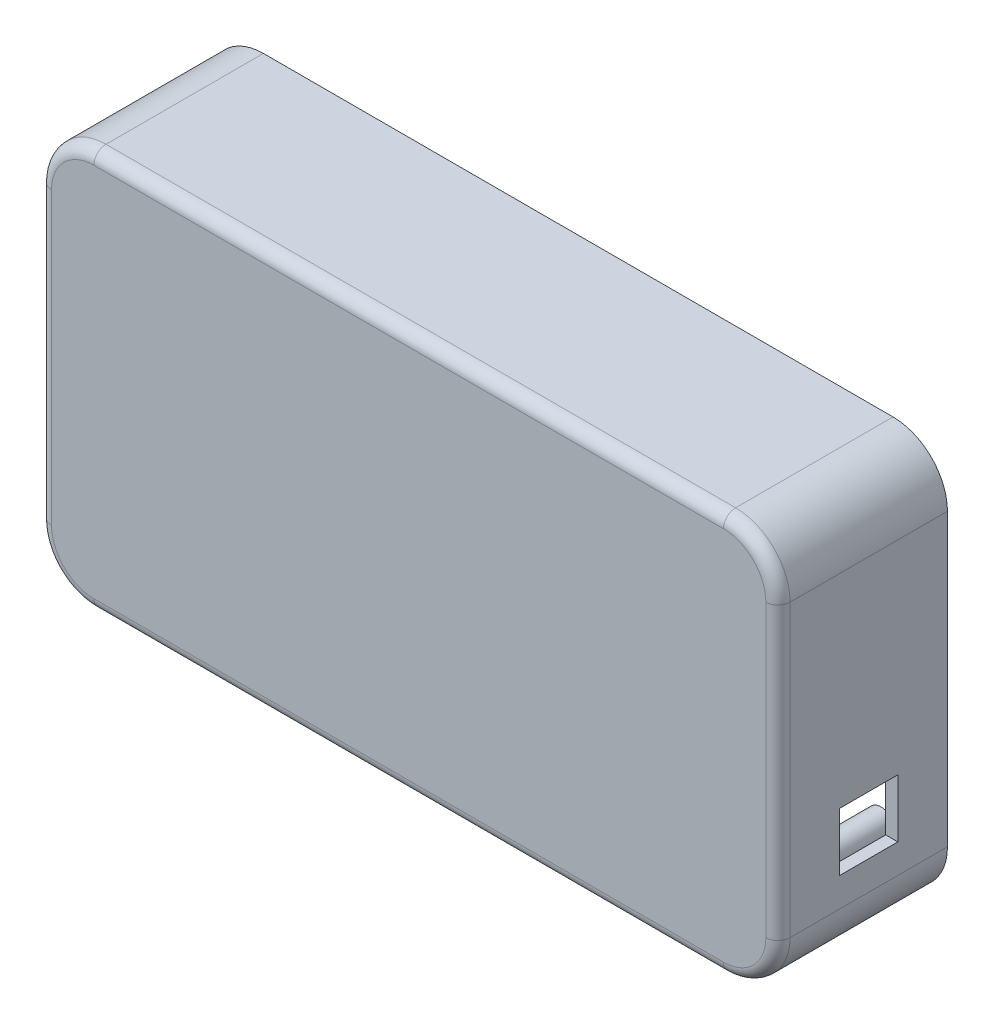
from build123d import *

# Parameters (mm, degrees)
EXTRUDE_1_DEPTH      = 70
SKETCH_1_4_R         = 5.55
CUT_EXTRUDE_1_DEPTH  = 65
CUT_EXTRUDE_2_DEPTH  = 5
SKETCH_1_6_R         = 5.55
SKETCH_1_6_R_2       = 2.55
CUT_EXTRUDE_3_DEPTH  = 5
SKETCH_1_7_R         = 2.55
CUT_EXTRUDE_4_DEPTH  = 40
SKETCH_1_8_R         = 2.55
CUT_EXTRUDE_5_DEPTH  = 40
SKETCH_1_10_R        = 2.55
CUT_EXTRUDE_6_DEPTH  = 40
SKETCH_1_11_R        = 2.55
CUT_EXTRUDE_7_DEPTH  = 40
SKETCH_1_12_R        = 5.55
SKETCH_1_12_R_2      = 2.55
CUT_EXTRUDE_8_DEPTH  = 5
SKETCH_1_13_R        = 5.55
SKETCH_1_13_R_2      = 2.55
CUT_EXTRUDE_9_DEPTH  = 5
SKETCH_1_14_R        = 5.55
SKETCH_1_14_R_2      = 2.55
CUT_EXTRUDE_10_DEPTH = 5
FILLET_2_R           = 5
SKETCH_14_W          = 50
SKETCH_14_H          = 20
CUT_EXTRUDE_11_DEPTH = 5
SKETCH_16_W          = 24
SKETCH_16_H          = 24
CUT_EXTRUDE_12_DEPTH = 5
SKETCH_18_W          = 24
SKETCH_18_H          = 24
CUT_EXTRUDE_13_DEPTH = 5
EXTRUDE_2_DEPTH      = 60
SKETCH_28_W          = 0.621951219
SKETCH_28_H          = 3
CUT_EXTRUDE_17_DEPTH = 1


with BuildPart() as part:
    # 草图1 → 凸台-拉伸1 (new body)
    with BuildSketch(Plane.XY):
        with BuildLine():
            Line((-130, 82.5), (130, 82.5))
            ThreePointArc((130, 82.5), (145.909902577, 75.909902577), (152.5, 60))
            Line((152.5, 60), (152.5, -60))
            ThreePointArc((152.5, -60), (145.909902577, -75.909902577), (130, -82.5))
            Line((130, -82.5), (-130, -82.5))
            ThreePointArc((-130, -82.5), (-145.909902577, -75.909902577), (-152.5, -60))
            Line((-152.5, -60), (-152.5, 60))
            ThreePointArc((-152.5, 60), (-145.909902577, 75.909902577), (-130, 82.5))
        make_face()
    extrude(amount=EXTRUDE_1_DEPTH)

    # 草图1<4> → 切除-拉伸1 (cut)
    with BuildSketch(Plane.XY):
        with BuildLine():
            Line((130, 77.5), (-130, 77.5))
            ThreePointArc((-130, 77.5), (-142.374368671, 72.374368671), (-147.5, 60))
            Line((-147.5, 60), (-147.5, -60))
            ThreePointArc((-147.5, -60), (-142.374368671, -72.374368671), (-130, -77.5))
            Line((-130, -77.5), (130, -77.5))
            ThreePointArc((130, -77.5), (142.374368671, -72.374368671), (147.5, -60))
            Line((147.5, -60), (147.5, 60))
            ThreePointArc((147.5, 60), (142.374368671, 72.374368671), (130, 77.5))
        make_face()
        with Locations((-130, -60)):
            Circle(SKETCH_1_4_R, mode=Mode.SUBTRACT)
        with Locations((130, -60)):
            Circle(SKETCH_1_4_R, mode=Mode.SUBTRACT)
        with Locations((-130, 60)):
            Circle(SKETCH_1_4_R, mode=Mode.SUBTRACT)
        with Locations((130, 60)):
            Circle(SKETCH_1_4_R, mode=Mode.SUBTRACT)
    extrude(amount=CUT_EXTRUDE_1_DEPTH, mode=Mode.SUBTRACT)

    # 草图1<5> → 切除-拉伸2 (cut)
    with BuildSketch(Plane.XY):
        with BuildLine():
            ThreePointArc((-130, 80.2), (-144.28355698, 74.28355698), (-150.2, 60))
            Line((-150.2, 60), (-150.2, -60))
            ThreePointArc((-150.2, -60), (-144.28355698, -74.28355698), (-130, -80.2))
            Line((-130, -80.2), (130, -80.2))
            ThreePointArc((130, -80.2), (144.28355698, -74.28355698), (150.2, -60))
            Line((150.2, -60), (150.2, 60))
            ThreePointArc((150.2, 60), (144.28355698, 74.28355698), (130, 80.2))
            Line((130, 80.2), (-130, 80.2))
        make_face()
        with BuildLine():
            ThreePointArc((-147.5, 60), (-142.374368671, 72.374368671), (-130, 77.5))
            Line((-130, 77.5), (130, 77.5))
            ThreePointArc((130, 77.5), (142.374368671, 72.374368671), (147.5, 60))
            Line((147.5, 60), (147.5, -60))
            ThreePointArc((147.5, -60), (142.374368671, -72.374368671), (130, -77.5))
            Line((130, -77.5), (-130, -77.5))
            ThreePointArc((-130, -77.5), (-142.374368671, -72.374368671), (-147.5, -60))
            Line((-147.5, -60), (-147.5, 60))
        make_face(mode=Mode.SUBTRACT)
    extrude(amount=CUT_EXTRUDE_2_DEPTH, mode=Mode.SUBTRACT)

    # 草图1<6> → 切除-拉伸3 (cut)
    with BuildSketch(Plane.XY):
        with Locations((130, 60)):
            Circle(SKETCH_1_6_R)
        with Locations((130, 60)):
            Circle(SKETCH_1_6_R_2, mode=Mode.SUBTRACT)
    extrude(amount=CUT_EXTRUDE_3_DEPTH, mode=Mode.SUBTRACT)

    # 草图1<7> → 切除-拉伸4 (cut)
    with BuildSketch(Plane.XY):
        with Locations((130, 60)):
            Circle(SKETCH_1_7_R)
    extrude(amount=CUT_EXTRUDE_4_DEPTH, mode=Mode.SUBTRACT)

    # 草图1<8> → 切除-拉伸5 (cut)
    with BuildSketch(Plane.XY):
        with Locations((130, -60)):
            Circle(SKETCH_1_8_R)
    extrude(amount=CUT_EXTRUDE_5_DEPTH, mode=Mode.SUBTRACT)

    # 草图1<10> → 切除-拉伸6 (cut)
    with BuildSketch(Plane.XY):
        with Locations((-130, -60)):
            Circle(SKETCH_1_10_R)
    extrude(amount=CUT_EXTRUDE_6_DEPTH, mode=Mode.SUBTRACT)

    # 草图1<11> → 切除-拉伸7 (cut)
    with BuildSketch(Plane.XY):
        with Locations((-130, 60)):
            Circle(SKETCH_1_11_R)
    extrude(amount=CUT_EXTRUDE_7_DEPTH, mode=Mode.SUBTRACT)

    # 草图1<12> → 切除-拉伸8 (cut)
    with BuildSketch(Plane.XY):
        with Locations((-130, 60)):
            Circle(SKETCH_1_12_R)
        with Locations((-130, 60)):
            Circle(SKETCH_1_12_R_2, mode=Mode.SUBTRACT)
    extrude(amount=CUT_EXTRUDE_8_DEPTH, mode=Mode.SUBTRACT)

    # 草图1<13> → 切除-拉伸9 (cut)
    with BuildSketch(Plane.XY):
        with Locations((-130, -60)):
            Circle(SKETCH_1_13_R)
        with Locations((-130, -60)):
            Circle(SKETCH_1_13_R_2, mode=Mode.SUBTRACT)
    extrude(amount=CUT_EXTRUDE_9_DEPTH, mode=Mode.SUBTRACT)

    # 草图1<14> → 切除-拉伸10 (cut)
    with BuildSketch(Plane.XY):
        with Locations((130, -60)):
            Circle(SKETCH_1_14_R)
        with Locations((130, -60)):
            Circle(SKETCH_1_14_R_2, mode=Mode.SUBTRACT)
    extrude(amount=CUT_EXTRUDE_10_DEPTH, mode=Mode.SUBTRACT)

    # 圆角2
    fillet_2_edges = [part.edges().sort_by_distance(p)[0] for p in [
        (-152.5, 0, 70),
        (0, -82.5, 70),
        (152.5, 0, 70),
        (0, 82.5, 70),
    ]]
    fillet(fillet_2_edges, radius=FILLET_2_R)

    # 草图14 → 切除-拉伸11 (cut)
    with BuildSketch(Plane.XZ.offset(82.5)):
        with Locations((0, 55)):
            Rectangle(SKETCH_14_W, SKETCH_14_H)
    extrude(amount=-CUT_EXTRUDE_11_DEPTH, mode=Mode.SUBTRACT)

    # 草图16 → 切除-拉伸12 (cut)
    with BuildSketch(Plane(origin=(152.5, 0, 0), x_dir=(0, 0, -1), z_dir=(1, 0, 0))):
        with Locations((-32.5, -36)):
            Rectangle(SKETCH_16_W, SKETCH_16_H)
    extrude(amount=-CUT_EXTRUDE_12_DEPTH, mode=Mode.SUBTRACT)

    # 草图18 → 切除-拉伸13 (cut)
    with BuildSketch(Plane.ZY.offset(152.5)):
        with Locations((32.5, -36)):
            Rectangle(SKETCH_18_W, SKETCH_18_H)
    extrude(amount=-CUT_EXTRUDE_13_DEPTH, mode=Mode.SUBTRACT)

    # 草图19 → 凸台-拉伸2 (add)
    with BuildSketch(Plane(origin=(0, 0, 65), x_dir=(-1, 0, 0), z_dir=(0, 0, -1))):
        with BuildLine():
            Line((-103, 50), (-18, 50))
            ThreePointArc((-18, 50), (-14, 46), (-18, 42))
            Line((-18, 42), (-103, 42))
            ThreePointArc((-103, 42), (-107, 46), (-103, 50))
        make_face()
        with BuildLine():
            Line((103, 50), (18, 50))
            ThreePointArc((18, 50), (14, 46), (18, 42))
            Line((18, 42), (103, 42))
            ThreePointArc((103, 42), (107, 46), (103, 50))
        make_face()
        with BuildLine():
            Line((-103, -10), (-18, -10))
            ThreePointArc((-18, -10), (-14, -14), (-18, -18))
            Line((-18, -18), (-103, -18))
            ThreePointArc((-103, -18), (-107, -14), (-103, -10))
        make_face()
        with BuildLine():
            Line((103, -10), (18, -10))
            ThreePointArc((18, -10), (14, -14), (18, -18))
            Line((18, -18), (103, -18))
            ThreePointArc((103, -18), (107, -14), (103, -10))
        make_face()
    extrude(amount=EXTRUDE_2_DEPTH)

    # 草图28 → 切除-拉伸17 (cut)
    # profile 1 of 12: a face of its own
    with BuildSketch(Plane(origin=(0, 0, 5), x_dir=(-1, 0, 0), z_dir=(0, 0, -1))):
        with BuildLine():
            Line((80.384146341, -13.06097561), (80.384146341, -12))
            Line((80.384146341, -12), (81.042682927, -12))
            Line((81.042682927, -12), (81.042682927, -15))
            Line((81.042682927, -15), (80.006859756, -15))
            add(Edge.make_bspline(
                [(80.006859756, -15), (79.961479418, -14.999503633), (79.87361159, -14.99854254), (79.746304446, -14.986562483), (79.627581035, -14.968820048), (79.517425839, -14.943151197), (79.415825389, -14.910343596), (79.323300006, -14.869429025), (79.238898444, -14.822319695), (79.164268715, -14.766238818), (79.097779475, -14.70359415), (79.040134554, -14.633409047), (78.99188706, -14.555403322), (78.952362713, -14.470154314), (78.921346151, -14.377583496), (78.900071449, -14.277464991), (78.886698413, -14.170330476), (78.885012621, -14.096458902), (78.884146341, -14.058498476)],
                knots=[0, 0, 0, 0, 1.298309684, 2.513856393, 3.656108695, 4.731525363, 5.747269452, 6.706842141, 7.622696522, 8.50723259, 9.371308978, 10.231556582, 11.09863924, 11.989139744, 12.915198226, 13.88644584, 14.913906774, 16, 16, 16, 16], degree=3))
            add(Edge.make_bspline(
                [(78.884146341, -14.058498476), (78.885013307, -14.021272958), (78.886711261, -13.948366695), (78.903581335, -13.842163665), (78.928685577, -13.740985732), (78.966317149, -13.646083274), (79.013511237, -13.556331972), (79.071468039, -13.472633969), (79.140376689, -13.395013177), (79.218344717, -13.323395194), (79.304335332, -13.259035564), (79.396592881, -13.203590213), (79.49402658, -13.156921785), (79.596579049, -13.119131351), (79.704536812, -13.090548423), (79.817779495, -13.071210485), (79.93615522, -13.060851645), (80.016749247, -13.060933819), (80.05773628, -13.06097561)],
                knots=[0, 0, 0, 0, 1.030031435, 2.017318961, 2.9707634, 3.911434012, 4.836705747, 5.773461207, 6.723043161, 7.705184701, 8.700351159, 9.692154612, 10.681034209, 11.68770297, 12.714187277, 13.76904456, 14.865421547, 16, 16, 16, 16], degree=3))
            Line((80.05773628, -13.06097561), (80.384146341, -13.06097561))
        make_face()
        with BuildLine():
            Line((80.401295732, -14.524390244), (80.401295732, -13.536585366))
            Line((80.401295732, -13.536585366), (80.118330793, -13.536585366))
            add(Edge.make_bspline(
                [(80.118330793, -13.536585366), (80.095064743, -13.536778598), (80.049963913, -13.537153174), (79.984709193, -13.543899544), (79.923688885, -13.553252093), (79.867329537, -13.566981838), (79.815053858, -13.583961658), (79.767798249, -13.605656177), (79.724860415, -13.631110707), (79.686055895, -13.66020658), (79.652613773, -13.694182881), (79.622773905, -13.731325445), (79.597461253, -13.772482976), (79.577874395, -13.818149594), (79.561318552, -13.86693942), (79.55107338, -13.92001949), (79.543823987, -13.97674328), (79.543071025, -14.015980331), (79.542682927, -14.036204268)],
                knots=[0, 0, 0, 0, 1.278264899, 2.477894098, 3.602370215, 4.669373304, 5.663063542, 6.619223296, 7.520996807, 8.402964925, 9.276935434, 10.134111266, 11.017943356, 11.922995833, 12.86038281, 13.844364746, 14.88892179, 16, 16, 16, 16], degree=3))
            add(Edge.make_bspline(
                [(79.542682927, -14.036204268), (79.543085748, -14.055853896), (79.543870529, -14.094135534), (79.550981171, -14.14956841), (79.561641382, -14.2015033), (79.576850556, -14.249559353), (79.597168084, -14.293637792), (79.621919072, -14.333929433), (79.65089816, -14.370630426), (79.684949961, -14.402947478), (79.722411139, -14.432460876), (79.765470638, -14.456841362), (79.812445817, -14.478173977), (79.864047707, -14.495139779), (79.919947072, -14.508144403), (79.980088873, -14.517877805), (80.044857485, -14.523603352), (80.089546175, -14.524122343), (80.112614329, -14.524390244)],
                knots=[0, 0, 0, 0, 1.096807385, 2.136813243, 3.115574441, 4.054422268, 4.94474187, 5.818891163, 6.689666352, 7.547538513, 8.435055958, 9.345744162, 10.302983784, 11.312439221, 12.373194966, 13.505006157, 14.712092391, 16, 16, 16, 16], degree=3))
            Line((80.112614329, -14.524390244), (80.401295732, -14.524390244))
        make_face(mode=Mode.SUBTRACT)
    # profile 2 of 12: a face of its own
    with BuildSketch(Plane(origin=(0, 0, 5), x_dir=(-1, 0, 0), z_dir=(0, 0, -1))):
        with BuildLine():
            Line((76.615853659, -13.06097561), (76.615853659, -12))
            Line((76.615853659, -12), (77.274390244, -12))
            Line((77.274390244, -12), (77.274390244, -15))
            Line((77.274390244, -15), (76.238567073, -15))
            add(Edge.make_bspline(
                [(76.238567073, -15), (76.193186735, -14.999503633), (76.105318907, -14.99854254), (75.978011763, -14.986562483), (75.859288352, -14.968820048), (75.749133156, -14.943151197), (75.647532706, -14.910343596), (75.555007323, -14.869429025), (75.470605761, -14.822319695), (75.395976032, -14.766238818), (75.329486792, -14.70359415), (75.271841871, -14.633409047), (75.223594377, -14.555403322), (75.18407003, -14.470154314), (75.153053468, -14.377583496), (75.131778766, -14.277464991), (75.11840573, -14.170330476), (75.116719938, -14.096458902), (75.115853659, -14.058498476)],
                knots=[0, 0, 0, 0, 1.298309684, 2.513856393, 3.656108695, 4.731525363, 5.747269452, 6.706842141, 7.622696522, 8.50723259, 9.371308978, 10.231556582, 11.09863924, 11.989139744, 12.915198226, 13.88644584, 14.913906774, 16, 16, 16, 16], degree=3))
            add(Edge.make_bspline(
                [(75.115853659, -14.058498476), (75.116720624, -14.021272958), (75.118418578, -13.948366695), (75.135288652, -13.842163665), (75.160392894, -13.740985732), (75.198024466, -13.646083274), (75.245218554, -13.556331972), (75.303175356, -13.472633969), (75.372084006, -13.395013177), (75.450052034, -13.323395194), (75.536042649, -13.259035564), (75.628300198, -13.203590213), (75.725733897, -13.156921785), (75.828286367, -13.119131351), (75.936244129, -13.090548423), (76.049486812, -13.071210485), (76.167862537, -13.060851645), (76.248456564, -13.060933819), (76.289443598, -13.06097561)],
                knots=[0, 0, 0, 0, 1.030031435, 2.017318961, 2.9707634, 3.911434012, 4.836705747, 5.773461207, 6.723043161, 7.705184701, 8.700351159, 9.692154612, 10.681034209, 11.68770297, 12.714187277, 13.76904456, 14.865421547, 16, 16, 16, 16], degree=3))
            Line((76.289443598, -13.06097561), (76.615853659, -13.06097561))
        make_face()
        with BuildLine():
            Line((76.633003049, -14.524390244), (76.633003049, -13.536585366))
            Line((76.633003049, -13.536585366), (76.35003811, -13.536585366))
            add(Edge.make_bspline(
                [(76.35003811, -13.536585366), (76.32677206, -13.536778598), (76.28167123, -13.537153174), (76.21641651, -13.543899544), (76.155396202, -13.553252093), (76.099036854, -13.566981838), (76.046761175, -13.583961658), (75.999505566, -13.605656177), (75.956567732, -13.631110707), (75.917763212, -13.66020658), (75.88432109, -13.694182881), (75.854481222, -13.731325445), (75.82916857, -13.772482976), (75.809581712, -13.818149594), (75.793025869, -13.86693942), (75.782780697, -13.92001949), (75.775531304, -13.97674328), (75.774778342, -14.015980331), (75.774390244, -14.036204268)],
                knots=[0, 0, 0, 0, 1.278264899, 2.477894098, 3.602370215, 4.669373304, 5.663063542, 6.619223296, 7.520996807, 8.402964925, 9.276935434, 10.134111266, 11.017943356, 11.922995833, 12.86038281, 13.844364746, 14.88892179, 16, 16, 16, 16], degree=3))
            add(Edge.make_bspline(
                [(75.774390244, -14.036204268), (75.774793065, -14.055853896), (75.775577846, -14.094135534), (75.782688488, -14.14956841), (75.793348699, -14.2015033), (75.808557873, -14.249559353), (75.828875402, -14.293637792), (75.853626389, -14.333929433), (75.882605477, -14.370630426), (75.916657278, -14.402947478), (75.954118456, -14.432460876), (75.997177956, -14.456841362), (76.044153134, -14.478173977), (76.095755024, -14.495139779), (76.151654389, -14.508144403), (76.21179619, -14.517877805), (76.276564802, -14.523603352), (76.321253492, -14.524122343), (76.344321646, -14.524390244)],
                knots=[0, 0, 0, 0, 1.096807385, 2.136813243, 3.115574441, 4.054422268, 4.94474187, 5.818891163, 6.689666352, 7.547538513, 8.435055958, 9.345744162, 10.302983784, 11.312439221, 12.373194966, 13.505006157, 14.712092391, 16, 16, 16, 16], degree=3))
            Line((76.344321646, -14.524390244), (76.633003049, -14.524390244))
        make_face(mode=Mode.SUBTRACT)
    # profile 3 of 12: a face of its own
    with BuildSketch(Plane(origin=(0, 0, 5), x_dir=(-1, 0, 0), z_dir=(0, 0, -1))):
        with BuildLine():
            add(Edge.make_bspline(
                [(71.054878049, -12.213224085), (71.092313954, -12.193187917), (71.16808542, -12.152634072), (71.288376922, -12.102350745), (71.414829145, -12.05927485), (71.547375381, -12.0239713), (71.686381903, -11.996470603), (71.831496485, -11.977327801), (71.983041955, -11.965734339), (72.086107156, -11.964198595), (72.138719512, -11.963414634)],
                knots=[0, 0, 0, 0, 0.905764502, 1.833296254, 2.778524791, 3.755102668, 4.758409924, 5.800558306, 6.877236841, 8, 8, 8, 8], degree=3))
            add(Edge.make_bspline(
                [(72.138719512, -11.963414634), (72.197083047, -11.96454775), (72.311079456, -11.966760968), (72.4771873, -11.986152858), (72.633963101, -12.016521922), (72.781360819, -12.059925766), (72.918993135, -12.116694451), (73.047296815, -12.185703034), (73.166623671, -12.266483507), (73.275104148, -12.360387598), (73.372163769, -12.465090021), (73.457753621, -12.578881528), (73.529232028, -12.70246211), (73.587900658, -12.835126345), (73.633675693, -12.976893338), (73.665872607, -13.127816679), (73.685809434, -13.287764783), (73.687934107, -13.397424433), (73.68902439, -13.453696646)],
                knots=[0, 0, 0, 0, 1.150308723, 2.246797832, 3.292262244, 4.295476905, 5.270793765, 6.222142612, 7.163057208, 8.105964619, 9.044318326, 9.972988713, 10.907280248, 11.852489879, 12.827864619, 13.838828932, 14.890987884, 16, 16, 16, 16], degree=3))
            add(Edge.make_bspline(
                [(73.68902439, -13.453696646), (73.688774385, -13.482672532), (73.688280447, -13.539920604), (73.681952291, -13.624735321), (73.673870863, -13.707589883), (73.66131352, -13.78833163), (73.644340638, -13.86675859), (73.625203756, -13.943611825), (73.601986605, -14.018346382), (73.573982001, -14.090499652), (73.543998851, -14.161214191), (73.509547635, -14.229584847), (73.47194546, -14.296221244), (73.429843274, -14.360211575), (73.384883978, -14.422598495), (73.335960982, -14.482670258), (73.284073913, -14.541219483), (73.20952413, -14.615466914), (73.109533314, -14.701022606), (72.98043563, -14.791769851), (72.841160246, -14.867308437), (72.692790137, -14.929082213), (72.535741153, -14.977948368), (72.369326733, -15.011861738), (72.19394845, -15.03288087), (72.073803279, -15.035332238), (72.012385671, -15.036585366)],
                knots=[0, 0, 0, 0, 0.804008257, 1.588490589, 2.359415033, 3.114115391, 3.85469397, 4.585808504, 5.311740349, 6.024805626, 6.733109078, 7.442635548, 8.148446986, 8.855465972, 9.567392887, 10.281829633, 11.004730757, 11.737679193, 13.200405481, 14.651363498, 16.109186693, 17.588340932, 19.105513233, 20.666480423, 22.295921515, 24, 24, 24, 24], degree=3))
            add(Edge.make_bspline(
                [(72.012385671, -15.036585366), (71.972551396, -15.036127525), (71.894167027, -15.035226604), (71.778440305, -15.028667414), (71.666608797, -15.018882987), (71.558806336, -15.003430009), (71.454409453, -14.985891423), (71.354310314, -14.961919143), (71.257485266, -14.935619047), (71.1953827, -14.913681806), (71.164634146, -14.902820122)],
                knots=[0, 0, 0, 0, 1.108229999, 2.180732801, 3.224212248, 4.230392862, 5.210078469, 6.168137424, 7.092998441, 8, 8, 8, 8], degree=3))
            Line((71.164634146, -14.902820122), (71.164634146, -14.304878049))
            add(Edge.make_bspline(
                [(71.164634146, -14.304878049), (71.194844233, -14.322549461), (71.255685046, -14.35813834), (71.352881554, -14.402388462), (71.454731064, -14.440140421), (71.561534128, -14.471066345), (71.673292379, -14.495027072), (71.7899784, -14.511951309), (71.911580223, -14.522524084), (71.994261501, -14.52376029), (72.036394817, -14.524390244)],
                knots=[0, 0, 0, 0, 0.9220621, 1.85696284, 2.810499976, 3.783315138, 4.785220574, 5.82089063, 6.889553879, 8, 8, 8, 8], degree=3))
            add(Edge.make_bspline(
                [(72.036394817, -14.524390244), (72.072448117, -14.523490586), (72.143275156, -14.521723199), (72.246855004, -14.508474899), (72.345191992, -14.486410493), (72.437909448, -14.45446052), (72.525789376, -14.414718102), (72.608136168, -14.365038309), (72.684947406, -14.306331997), (72.756304136, -14.239598214), (72.820741068, -14.165513913), (72.877108484, -14.085055912), (72.924711108, -13.99879371), (72.963916273, -13.906942801), (72.993269613, -13.809028733), (73.015218236, -13.706036547), (73.027710095, -13.597104625), (73.029546406, -13.522706367), (73.030487805, -13.484565549)],
                knots=[0, 0, 0, 0, 1.068568043, 2.099211781, 3.089950087, 4.051000015, 5.001416445, 5.944011771, 6.895283926, 7.862423631, 8.835401866, 9.800725282, 10.769101412, 11.751137938, 12.755343674, 13.794527825, 14.86934834, 16, 16, 16, 16], degree=3))
            add(Edge.make_bspline(
                [(73.030487805, -13.484565549), (73.029684754, -13.445861629), (73.028122444, -13.370564357), (73.017030423, -13.260887053), (72.996504956, -13.158232526), (72.970294933, -13.061416711), (72.934557914, -12.971553544), (72.891565305, -12.887882731), (72.840576437, -12.810825314), (72.781497783, -12.741183722), (72.716205587, -12.678681463), (72.645007643, -12.623707833), (72.567287043, -12.578274514), (72.484662809, -12.539821541), (72.395705346, -12.511792435), (72.301536177, -12.490316686), (72.201371264, -12.477696777), (72.132657154, -12.476315336), (72.097560976, -12.475609756)],
                knots=[0, 0, 0, 0, 1.192903147, 2.320756001, 3.39190871, 4.416435883, 5.407770308, 6.366507788, 7.31123856, 8.248933498, 9.175230166, 10.092622087, 11.014215195, 11.94450602, 12.89540485, 13.882764997, 14.918608447, 16, 16, 16, 16], degree=3))
            add(Edge.make_bspline(
                [(72.097560976, -12.475609756), (72.0565414, -12.476373932), (71.978252447, -12.477832419), (71.866732776, -12.491844757), (71.766314049, -12.513311921), (71.705734271, -12.537323579), (71.676829268, -12.548780488)],
                knots=[0, 0, 0, 0, 1.144267593, 2.183921005, 3.133477062, 4, 4, 4, 4], degree=3))
            Line((71.676829268, -12.548780488), (71.676829268, -13.170731707))
            Line((71.676829268, -13.170731707), (72.298780488, -13.170731707))
            Line((72.298780488, -13.170731707), (72.298780488, -13.682926829))
            Line((72.298780488, -13.682926829), (71.054878049, -13.682926829))
            Line((71.054878049, -13.682926829), (71.054878049, -12.213224085))
        make_face()
    # profile 4 of 12: a face of its own
    with BuildSketch(Plane(origin=(0, 0, 5), x_dir=(-1, 0, 0), z_dir=(0, 0, -1))):
        Polygon((67.506097561, -12), (69.298780488, -12), (69.298780488, -15), (67.579268293, -15), (67.579268293, -14.487804878), (68.653391768, -14.487804878), (68.653391768, -13.756097561), (67.652439024, -13.756097561), (67.652439024, -13.243902439), (68.640243902, -13.243902439), (68.640243902, -12.512195122), (67.506097561, -12.512195122), align=None)
    # profile 5 of 12: a face of its own
    with BuildSketch(Plane(origin=(0, 0, 5), x_dir=(-1, 0, 0), z_dir=(0, 0, -1))):
        with BuildLine():
            Line((63.408536585, -12), (64.215129573, -12))
            Line((64.215129573, -12), (65.14691311, -13.311356707))
            add(Edge.make_bspline(
                [(65.14691311, -13.311356707), (65.153105315, -13.320824523), (65.166724093, -13.341647492), (65.186772178, -13.377155315), (65.206896036, -13.420301308), (65.220709935, -13.451387192), (65.22808689, -13.467987805)],
                knots=[0, 0, 0, 0, 0.768222517, 1.689584372, 2.76618222, 4, 4, 4, 4], degree=3))
            Line((65.22808689, -13.467987805), (65.237804878, -13.467987805))
            Line((65.237804878, -13.467987805), (65.237804878, -12))
            Line((65.237804878, -12), (65.859756098, -12))
            Line((65.859756098, -12), (65.859756098, -15))
            Line((65.859756098, -15), (65.237804878, -15))
            Line((65.237804878, -15), (65.237804878, -13.582317073))
            Line((65.237804878, -13.582317073), (65.22808689, -13.582317073))
            add(Edge.make_bspline(
                [(65.22808689, -13.582317073), (65.213895948, -13.611543837), (65.187235364, -13.666452285), (65.15547834, -13.71857224), (65.140625, -13.742949695)],
                knots=[0, 0, 0, 0, 1.064563444, 2, 2, 2, 2], degree=3))
            Line((65.140625, -13.742949695), (64.241996951, -15))
            Line((64.241996951, -15), (63.481707317, -15))
            Line((63.481707317, -15), (64.578696646, -13.568597561))
            Line((64.578696646, -13.568597561), (63.408536585, -12))
        make_face()
    # profile 6 of 12: a face of its own
    with BuildSketch(Plane(origin=(0, 0, 5), x_dir=(-1, 0, 0), z_dir=(0, 0, -1))):
        with Locations((61.634146341, -13.5)):
            Rectangle(SKETCH_28_W, SKETCH_28_H)
    # profile 7 of 12: a face of its own
    with BuildSketch(Plane(origin=(0, 0, 5), x_dir=(-1, 0, 0), z_dir=(0, 0, -1))):
        with BuildLine():
            add(Edge.make_bspline(
                [(56.923780488, -14.193407012), (56.9285335, -14.156820247), (56.937841615, -14.085170149), (56.951659948, -13.980215183), (56.964280761, -13.880180858), (56.975514794, -13.785240059), (56.986615271, -13.695352233), (56.996277551, -13.610548866), (57.004734176, -13.530675438), (57.012961162, -13.456022718), (57.019588694, -13.386238454), (57.026072463, -13.321679317), (57.031303632, -13.262038633), (57.035094384, -13.207319415), (57.038735695, -13.157611348), (57.041075838, -13.113014802), (57.04215283, -13.073556627), (57.04251466, -13.048971386), (57.042682927, -13.03753811)],
                knots=[0, 0, 0, 0, 1.523421869, 2.983410193, 4.371160344, 5.686705542, 6.931005549, 8.110953867, 9.210965315, 10.247551913, 11.212088821, 12.105383437, 12.926721091, 13.68406122, 14.370209323, 14.984725295, 15.527850191, 16, 16, 16, 16], degree=3))
            add(Edge.make_bspline(
                [(57.042682927, -13.03753811), (57.042142468, -13.013698455), (57.041127238, -12.9689166), (57.033571031, -12.90632914), (57.020135813, -12.85315855), (57.001483732, -12.809066113), (56.976766347, -12.774012017), (56.945449901, -12.749089074), (56.908474102, -12.733893397), (56.882005274, -12.732451987), (56.868330793, -12.731707317)],
                knots=[0, 0, 0, 0, 1.448452767, 2.720861672, 3.821719873, 4.770439391, 5.615739201, 6.39871397, 7.172734258, 8, 8, 8, 8], degree=3))
            add(Edge.make_bspline(
                [(56.868330793, -12.731707317), (56.853587387, -12.732306395), (56.82425962, -12.73349809), (56.781583022, -12.744963169), (56.741050683, -12.762839145), (56.702687376, -12.787999483), (56.666711617, -12.820513922), (56.632331092, -12.859597151), (56.600182939, -12.905828453), (56.57103626, -12.958721006), (56.544369747, -13.016826601), (56.520626677, -13.079358731), (56.501837734, -13.146310085), (56.484834947, -13.216731212), (56.472364865, -13.291234839), (56.46427607, -13.369724177), (56.458031829, -13.452073694), (56.457558892, -13.508371322), (56.457317073, -13.537157012)],
                knots=[0, 0, 0, 0, 0.714230219, 1.420755723, 2.128732248, 2.857189196, 3.636687255, 4.475325276, 5.378384261, 6.363729259, 7.402314615, 8.479262945, 9.606001351, 10.774654019, 11.993946383, 13.268450415, 14.603324099, 16, 16, 16, 16], degree=3))
            add(Edge.make_bspline(
                [(56.457317073, -13.537157012), (56.458370313, -13.577783008), (56.460434027, -13.657385408), (56.474703426, -13.7740045), (56.49931683, -13.884823792), (56.533796663, -13.990129186), (56.577722031, -14.089884727), (56.631974227, -14.183990061), (56.696382171, -14.271950364), (56.76924919, -14.354557662), (56.851552626, -14.428712215), (56.941936362, -14.493852444), (57.04010807, -14.548918314), (57.146233591, -14.593569343), (57.259777446, -14.628521909), (57.381033291, -14.652663641), (57.509712239, -14.667884254), (57.598088176, -14.669765427), (57.643483232, -14.670731707)],
                knots=[0, 0, 0, 0, 1.053066179, 2.063373308, 3.040084114, 3.991370503, 4.931251778, 5.860691054, 6.801285957, 7.752969819, 8.711245466, 9.666741759, 10.635413037, 11.622584861, 12.645981234, 13.709652112, 14.823543229, 16, 16, 16, 16], degree=3))
            add(Edge.make_bspline(
                [(57.643483232, -14.670731707), (57.691770463, -14.669682971), (57.786681994, -14.667621614), (57.925618531, -14.646634178), (58.05877916, -14.614512666), (58.185350097, -14.567869696), (58.305879033, -14.508505973), (58.420090935, -14.436305836), (58.527573256, -14.350179777), (58.627716265, -14.252444303), (58.719528692, -14.145874805), (58.799029893, -14.031599934), (58.867042563, -13.912121761), (58.922797211, -13.786981327), (58.965880248, -13.655965478), (58.995808562, -13.519377198), (59.014755312, -13.377245324), (59.017099435, -13.280548565), (59.018292683, -13.23132622)],
                knots=[0, 0, 0, 0, 1.043032563, 2.050144843, 3.030117198, 3.999577363, 4.959258962, 5.929375104, 6.914182594, 7.930717372, 8.950185061, 9.949968611, 10.934931123, 11.917695218, 12.906276573, 13.910555001, 14.936392663, 16, 16, 16, 16], degree=3))
            add(Edge.make_bspline(
                [(59.018292683, -13.23132622), (59.017195193, -13.183449991), (59.015050188, -13.089877669), (58.998319388, -12.953418626), (58.970588654, -12.824671204), (58.930929507, -12.704050296), (58.88067864, -12.591080483), (58.81827156, -12.486480955), (58.745477085, -12.389126504), (58.661169463, -12.3006331), (58.567620454, -12.221333921), (58.465518707, -12.152051735), (58.355184328, -12.093743329), (58.236900493, -12.04552178), (58.110468371, -12.008369207), (57.976078808, -11.98253809), (57.833873053, -11.9660083), (57.736328077, -11.964293242), (57.686356707, -11.963414634)],
                knots=[0, 0, 0, 0, 1.103832906, 2.157400693, 3.164988995, 4.136318075, 5.080418332, 6.010382147, 6.939327984, 7.878033749, 8.82271673, 9.762399076, 10.717762981, 11.695343904, 12.703392038, 13.751327329, 14.848026231, 16, 16, 16, 16], degree=3))
            add(Edge.make_bspline(
                [(57.686356707, -11.963414634), (57.647278037, -11.96394929), (57.569978125, -11.965006869), (57.455305947, -11.973877803), (57.34328447, -11.988017937), (57.233922149, -12.008020947), (57.127244493, -12.033824296), (57.023220241, -12.065258701), (56.92157097, -12.102276307), (56.855970811, -12.131653078), (56.823170732, -12.146341463)],
                knots=[0, 0, 0, 0, 1.054297098, 2.085461798, 3.101337278, 4.099692842, 5.083579589, 6.061105223, 7.030552611, 8, 8, 8, 8], degree=3))
            Line((56.823170732, -12.146341463), (56.823170732, -11.754192073))
            add(Edge.make_bspline(
                [(56.823170732, -11.754192073), (56.853888781, -11.741596655), (56.9166747, -11.715852349), (57.01602688, -11.684012255), (57.122076945, -11.657448341), (57.234559305, -11.634871906), (57.353975515, -11.61899115), (57.479759753, -11.606114535), (57.612334231, -11.598707521), (57.702925589, -11.597948833), (57.749237805, -11.597560976)],
                knots=[0, 0, 0, 0, 0.842369109, 1.721753814, 2.644852369, 3.61605255, 4.631689652, 5.700936581, 6.824670199, 8, 8, 8, 8], degree=3))
            add(Edge.make_bspline(
                [(57.749237805, -11.597560976), (57.781257762, -11.597877493), (57.844577338, -11.598503406), (57.93838585, -11.603872677), (58.029989866, -11.612088549), (58.119128674, -11.62510507), (58.206244485, -11.640089459), (58.290881626, -11.659702006), (58.373165931, -11.682729038), (58.453537407, -11.708109607), (58.531204684, -11.738147765), (58.606865627, -11.770911324), (58.679459681, -11.808686428), (58.750498454, -11.848424448), (58.819336968, -11.891923159), (58.885329754, -11.939363254), (58.949308325, -11.990019796), (59.010698061, -12.04387495), (59.068702736, -12.101109019), (59.124012401, -12.160093971), (59.175426207, -12.221550886), (59.222327241, -12.28600649), (59.265785594, -12.352415001), (59.306124891, -12.420777768), (59.341312286, -12.492405919), (59.374150938, -12.565527014), (59.402048312, -12.641696254), (59.426671, -12.71966647), (59.447205274, -12.800248356), (59.464413013, -12.882806198), (59.477434994, -12.967938419), (59.4872162, -13.055262706), (59.493058073, -13.145117304), (59.493618806, -13.205784135), (59.493902439, -13.236471037)],
                knots=[0, 0, 0, 0, 1.139729665, 2.253819379, 3.34386206, 4.412484346, 5.459643503, 6.489680893, 7.503419623, 8.500893191, 9.488516358, 10.466495726, 11.434212398, 12.400073063, 13.363549001, 14.331051701, 15.29187366, 16.267521502, 17.236426053, 18.19148447, 19.145072434, 20.086618682, 21.027284935, 21.969612712, 22.909985449, 23.866608255, 24.821666671, 25.795638972, 26.776155499, 27.780524128, 28.796461688, 29.840650861, 30.907743603, 32, 32, 32, 32], degree=3))
            add(Edge.make_bspline(
                [(59.493902439, -13.236471037), (59.493695532, -13.268116273), (59.49328627, -13.330710268), (59.486312106, -13.423536084), (59.477255286, -13.514447395), (59.462373698, -13.603193413), (59.445172794, -13.690373538), (59.422462454, -13.775265309), (59.397101524, -13.858696943), (59.366306519, -13.939658693), (59.33311183, -14.019447329), (59.294198113, -14.096450403), (59.252940127, -14.172323435), (59.206089858, -14.245244548), (59.156533445, -14.317207646), (59.102121431, -14.386526844), (59.044250157, -14.454518994), (58.982104803, -14.519628221), (58.917526305, -14.582516968), (58.849543727, -14.640770562), (58.780150435, -14.695898149), (58.707775643, -14.746132737), (58.633343538, -14.792804591), (58.556069908, -14.834636331), (58.477304331, -14.874016895), (58.395809573, -14.908113147), (58.312119342, -14.938645675), (58.225976171, -14.964645447), (58.137764098, -14.987293957), (58.046996268, -15.004676228), (57.954163819, -15.019033671), (57.85881628, -15.029510054), (57.761306833, -15.034969058), (57.695508882, -15.03604374), (57.662347561, -15.036585366)],
                knots=[0, 0, 0, 0, 1.055967408, 2.088694104, 3.105731401, 4.104304765, 5.090957784, 6.070554152, 7.036175772, 8.000183181, 8.960596085, 9.919153932, 10.878534348, 11.841954102, 12.810587284, 13.794037141, 14.781919379, 15.789686715, 16.797253329, 17.789283132, 18.776653381, 19.754141443, 20.728333929, 21.707496606, 22.685977379, 23.666440556, 24.654322793, 25.658289687, 26.668682805, 27.692755764, 28.741592915, 29.803576736, 30.893030921, 32, 32, 32, 32], degree=3))
            add(Edge.make_bspline(
                [(57.662347561, -15.036585366), (57.600929078, -15.035524312), (57.481008477, -15.033452588), (57.305857923, -15.013017654), (57.139359562, -14.982640887), (56.982330732, -14.936871168), (56.833724107, -14.879876709), (56.694426556, -14.809457022), (56.564396732, -14.725856977), (56.444142526, -14.630896356), (56.335650974, -14.525391996), (56.240551487, -14.41126188), (56.160563265, -14.288569874), (56.095193739, -14.158109361), (56.043776929, -14.019993019), (56.008170223, -13.873789209), (55.985874338, -13.720007388), (55.983114027, -13.61478803), (55.981707317, -13.561166159)],
                knots=[0, 0, 0, 0, 1.172184142, 2.288708891, 3.362594693, 4.40006907, 5.406766622, 6.397653929, 7.374570214, 8.353577624, 9.318387134, 10.258888517, 11.184236923, 12.108404466, 13.039677363, 13.991781463, 14.976572015, 16, 16, 16, 16], degree=3))
            add(Edge.make_bspline(
                [(55.981707317, -13.561166159), (55.982599939, -13.517307373), (55.984346649, -13.431483097), (55.997562438, -13.306064804), (56.019687352, -13.18707776), (56.051201722, -13.074833385), (56.091023564, -12.968945894), (56.140687184, -12.87018294), (56.198348706, -12.777515605), (56.26519056, -12.692899104), (56.338171106, -12.616403431), (56.41577788, -12.54909255), (56.498402221, -12.4926458), (56.584659983, -12.446014238), (56.675550085, -12.410353548), (56.77019036, -12.384602544), (56.869317855, -12.368668746), (56.936868554, -12.366802762), (56.971227134, -12.365853659)],
                knots=[0, 0, 0, 0, 1.212531633, 2.372720733, 3.482527589, 4.555078219, 5.592301276, 6.605480189, 7.606836371, 8.604971677, 9.581315616, 10.526528093, 11.439897802, 12.342706025, 13.232054118, 14.133138835, 15.050450991, 16, 16, 16, 16], degree=3))
            add(Edge.make_bspline(
                [(56.971227134, -12.365853659), (56.988005936, -12.366179315), (57.02069372, -12.366813747), (57.068751448, -12.37188284), (57.114288103, -12.381345582), (57.158153517, -12.392904036), (57.199447613, -12.409400495), (57.239095234, -12.428350958), (57.275660313, -12.452447572), (57.310505241, -12.478452883), (57.342697103, -12.507215449), (57.370058599, -12.539784841), (57.394454692, -12.574134305), (57.414544877, -12.611333034), (57.429784781, -12.651262224), (57.441945057, -12.693079807), (57.450104135, -12.737519906), (57.452101311, -12.768068765), (57.453125, -12.783727134)],
                knots=[0, 0, 0, 0, 1.130917494, 2.203207897, 3.251066508, 4.263779692, 5.256005313, 6.243982268, 7.220201173, 8.201476495, 9.174309855, 10.12162718, 11.06230394, 12.010491561, 12.962152409, 13.937779692, 14.942971815, 16, 16, 16, 16], degree=3))
            Line((57.453125, -12.783727134), (57.466844512, -12.783727134))
            add(Edge.make_bspline(
                [(57.466844512, -12.783727134), (57.479252716, -12.750828507), (57.503073038, -12.687672239), (57.549262982, -12.601528479), (57.604193982, -12.52873429), (57.666951492, -12.469173602), (57.73722629, -12.422317969), (57.815424311, -12.389643467), (57.900979344, -12.368841502), (57.960812391, -12.366869098), (57.991615854, -12.365853659)],
                knots=[0, 0, 0, 0, 1.166057998, 2.238509006, 3.231342415, 4.179679313, 5.09695759, 6.017803703, 6.979518613, 8, 8, 8, 8], degree=3))
            add(Edge.make_bspline(
                [(57.991615854, -12.365853659), (58.014706911, -12.366524554), (58.059766749, -12.367833737), (58.125740052, -12.377738881), (58.188054046, -12.394227271), (58.246914085, -12.417306066), (58.302291675, -12.446620074), (58.354092052, -12.482752678), (58.40158374, -12.526394554), (58.446258796, -12.57523046), (58.485992665, -12.630239821), (58.521461177, -12.690056989), (58.550187293, -12.755530909), (58.574335742, -12.825681956), (58.593186806, -12.900630377), (58.606095043, -12.98077248), (58.614187322, -13.065763822), (58.615289323, -13.124219024), (58.615853659, -13.154153963)],
                knots=[0, 0, 0, 0, 0.978330842, 1.90911263, 2.819958291, 3.704727685, 4.582578498, 5.46974011, 6.373109089, 7.310697097, 8.270148368, 9.243802011, 10.252329254, 11.294282258, 12.385216397, 13.522967731, 14.731510496, 16, 16, 16, 16], degree=3))
            add(Edge.make_bspline(
                [(58.615853659, -13.154153963), (58.615342423, -13.193060551), (58.614342647, -13.26914656), (58.602229961, -13.380252788), (58.584561982, -13.486115967), (58.557909482, -13.586143255), (58.525052239, -13.681305258), (58.483553697, -13.770420025), (58.435653853, -13.854677813), (58.379671089, -13.931784821), (58.318888135, -14.001640376), (58.254893374, -14.063789585), (58.186448086, -14.114974037), (58.115690673, -14.158383799), (58.04087017, -14.190807618), (57.963033961, -14.214419386), (57.881857578, -14.229328979), (57.826474224, -14.230907258), (57.79839939, -14.231707317)],
                knots=[0, 0, 0, 0, 1.239844362, 2.424648769, 3.559234923, 4.658481727, 5.720988926, 6.764765193, 7.78804456, 8.806407067, 9.796806516, 10.737810622, 11.644214127, 12.51625241, 13.378587363, 14.235706598, 15.105647435, 16, 16, 16, 16], degree=3))
            add(Edge.make_bspline(
                [(57.79839939, -14.231707317), (57.773750512, -14.231085594), (57.726574789, -14.229895672), (57.659482341, -14.21686737), (57.599222481, -14.196933866), (57.54681804, -14.166964513), (57.501160662, -14.129478847), (57.463951338, -14.082595402), (57.432666971, -14.028301288), (57.419779683, -13.987553029), (57.413109756, -13.966463415)],
                knots=[0, 0, 0, 0, 1.162500449, 2.224920718, 3.215234658, 4.14607917, 5.059715227, 5.987248356, 6.958282961, 8, 8, 8, 8], degree=3))
            Line((57.413109756, -13.966463415), (57.402820122, -13.966463415))
            add(Edge.make_bspline(
                [(57.402820122, -13.966463415), (57.399899344, -13.984779296), (57.394012197, -14.021696947), (57.386564956, -14.058331855), (57.3828125, -14.076791159)],
                knots=[0, 0, 0, 0, 0.992256058, 2, 2, 2, 2], degree=3))
            add(Edge.make_bspline(
                [(57.3828125, -14.076791159), (57.379027067, -14.095817677), (57.371328472, -14.134512709), (57.365677329, -14.173559634), (57.362804878, -14.193407012)],
                knots=[0, 0, 0, 0, 0.983408862, 2, 2, 2, 2], degree=3))
            Line((57.362804878, -14.193407012), (56.923780488, -14.193407012))
        make_face()
        with BuildLine():
            add(Edge.make_bspline(
                [(58.140243902, -13.157583841), (58.139516872, -13.126272845), (58.13813833, -13.066903256), (58.12387219, -12.982966104), (58.100082523, -12.909338545), (58.067026767, -12.846501736), (58.026271758, -12.794961242), (57.976368476, -12.758149418), (57.919202037, -12.734989559), (57.878269699, -12.732819934), (57.857278963, -12.731707317)],
                knots=[0, 0, 0, 0, 1.312889843, 2.489404372, 3.558976127, 4.546237303, 5.455384107, 6.290182479, 7.123179112, 8, 8, 8, 8], degree=3))
            add(Edge.make_bspline(
                [(57.857278963, -12.731707317), (57.841604924, -12.732387067), (57.810898326, -12.733718747), (57.766231029, -12.743601329), (57.7243876, -12.760506942), (57.685075523, -12.784311268), (57.648473006, -12.815084177), (57.61382827, -12.851904064), (57.582560469, -12.895750785), (57.554125197, -12.945661435), (57.528664049, -13.00080281), (57.506595264, -13.060555535), (57.486774036, -13.124128859), (57.471683906, -13.192449318), (57.459728126, -13.264971863), (57.451288309, -13.341683039), (57.446034248, -13.422563232), (57.44543141, -13.477887949), (57.445121951, -13.50628811)],
                knots=[0, 0, 0, 0, 0.776992938, 1.52218648, 2.255723859, 3.006112531, 3.79139439, 4.620435856, 5.506999125, 6.455279787, 7.46579491, 8.515454568, 9.612539721, 10.765703712, 11.982183725, 13.256427753, 14.591625987, 16, 16, 16, 16], degree=3))
            add(Edge.make_bspline(
                [(57.445121951, -13.50628811), (57.445824002, -13.533234646), (57.44715487, -13.584316859), (57.461751001, -13.656219148), (57.484696702, -13.719204904), (57.518158514, -13.771965303), (57.559870376, -13.814116336), (57.608824954, -13.844381443), (57.664467923, -13.863116443), (57.703735643, -13.864919342), (57.724085366, -13.865853659)],
                knots=[0, 0, 0, 0, 1.259237396, 2.387120666, 3.417150684, 4.379339575, 5.287239723, 6.16811719, 7.050662774, 8, 8, 8, 8], degree=3))
            add(Edge.make_bspline(
                [(57.724085366, -13.865853659), (57.738814931, -13.865173511), (57.768025023, -13.863824716), (57.810777747, -13.853616775), (57.851852575, -13.837726509), (57.890369696, -13.814340928), (57.92688015, -13.78470309), (57.961034784, -13.748270074), (57.99371324, -13.705851331), (58.023563868, -13.65739309), (58.050731503, -13.604577248), (58.074746092, -13.548397045), (58.095342263, -13.489619305), (58.111920871, -13.428286451), (58.124478168, -13.364268454), (58.133403718, -13.297642225), (58.139454986, -13.228388464), (58.139978365, -13.181415593), (58.140243902, -13.157583841)],
                knots=[0, 0, 0, 0, 0.783056021, 1.552872609, 2.326684812, 3.117838026, 3.939645892, 4.821723631, 5.768768003, 6.784372599, 7.845467318, 8.926477145, 10.032724663, 11.156717518, 12.304018594, 13.501301739, 14.732281981, 16, 16, 16, 16], degree=3))
        make_face(mode=Mode.SUBTRACT)
    # profile 8 of 12: a face of its own
    with BuildSketch(Plane(origin=(0, 0, 5), x_dir=(-1, 0, 0), z_dir=(0, 0, -1))):
        with BuildLine():
            Line((52.286585366, -14.12195122), (53.084603659, -12))
            Line((53.084603659, -12), (53.786585366, -12))
            Line((53.786585366, -12), (54.554878049, -14.12195122))
            Line((54.554878049, -14.12195122), (53.885480183, -14.12195122))
            Line((53.885480183, -14.12195122), (53.4921875, -12.801448171))
            add(Edge.make_bspline(
                [(53.4921875, -12.801448171), (53.482566666, -12.767031927), (53.464158559, -12.7011813), (53.44238852, -12.606277283), (53.427269101, -12.519838707), (53.422831683, -12.464983981), (53.420731707, -12.43902439)],
                knots=[0, 0, 0, 0, 1.158444002, 2.216519121, 3.155980933, 4, 4, 4, 4], degree=3))
            Line((53.420731707, -12.43902439), (53.41101372, -12.43902439))
            add(Edge.make_bspline(
                [(53.41101372, -12.43902439), (53.407907589, -12.465179027), (53.401437593, -12.519658522), (53.384649095, -12.604254216), (53.363135079, -12.695220881), (53.345337988, -12.757688465), (53.336128049, -12.790015244)],
                knots=[0, 0, 0, 0, 0.879203252, 1.831359759, 2.877735501, 4, 4, 4, 4], degree=3))
            Line((53.336128049, -12.790015244), (52.937690549, -14.12195122))
            Line((52.937690549, -14.12195122), (52.286585366, -14.12195122))
        make_face()
    # profile 9 of 12: a face of its own
    with BuildSketch(Plane(origin=(0, 0, 5), x_dir=(-1, 0, 0), z_dir=(0, 0, -1))):
        with BuildLine():
            Line((49.432926829, -15.036585366), (49.432926829, -12))
            Line((49.432926829, -12), (50.054878049, -12))
            Line((50.054878049, -12), (50.054878049, -14.328315549))
            add(Edge.make_bspline(
                [(50.054878049, -14.328315549), (50.075889633, -14.311648778), (50.120045104, -14.276623854), (50.196115915, -14.231481713), (50.281675386, -14.186826371), (50.376087833, -14.147348965), (50.473631134, -14.112041721), (50.569009096, -14.082523689), (50.660798074, -14.061551975), (50.720778835, -14.052964228), (50.75, -14.048780488)],
                knots=[0, 0, 0, 0, 0.848655958, 1.783435448, 2.795770279, 3.904546823, 5.021507539, 6.081226869, 7.06522051, 8, 8, 8, 8], degree=3))
            Line((50.75, -14.048780488), (50.75, -14.583269817))
            add(Edge.make_bspline(
                [(50.75, -14.583269817), (50.706039386, -14.59658127), (50.619035952, -14.622926265), (50.4922396, -14.669147819), (50.369449667, -14.718478564), (50.251817895, -14.773625703), (50.13842123, -14.832685094), (50.028960379, -14.895126355), (49.924776246, -14.963487362), (49.858216827, -15.012287356), (49.82507622, -15.036585366)],
                knots=[0, 0, 0, 0, 1.064073614, 2.105931847, 3.125864915, 4.129294696, 5.114699703, 6.087842653, 7.047917545, 8, 8, 8, 8], degree=3))
            Line((49.82507622, -15.036585366), (49.432926829, -15.036585366))
        make_face()
    # profile 10 of 12: a face of its own
    with BuildSketch(Plane(origin=(0, 0, 5), x_dir=(-1, 0, 0), z_dir=(0, 0, -1))):
        with BuildLine():
            add(Edge.make_bspline(
                [(47.31097561, -12.29382622), (47.309765194, -12.316871097), (47.307402648, -12.361851131), (47.285615237, -12.425649223), (47.251371839, -12.483366314), (47.202772251, -12.531738517), (47.146007768, -12.57126495), (47.083131754, -12.60149663), (47.014251527, -12.618755219), (46.966556487, -12.620872708), (46.94226372, -12.62195122)],
                knots=[0, 0, 0, 0, 1.0033009, 1.958288081, 2.909935628, 3.910058237, 4.925564025, 5.919195081, 6.940172586, 8, 8, 8, 8], degree=3))
            add(Edge.make_bspline(
                [(46.94226372, -12.62195122), (46.917751655, -12.620981248), (46.869946719, -12.61908955), (46.801392266, -12.600528978), (46.738489452, -12.571265437), (46.683224207, -12.530056232), (46.637726956, -12.480079211), (46.60314057, -12.423559863), (46.583319443, -12.360268461), (46.580635683, -12.316252553), (46.579268293, -12.29382622)],
                knots=[0, 0, 0, 0, 1.077304024, 2.10102452, 3.10319791, 4.116827478, 5.114741449, 6.063058229, 7.013118137, 8, 8, 8, 8], degree=3))
            add(Edge.make_bspline(
                [(46.579268293, -12.29382622), (46.580596845, -12.270256975), (46.583173393, -12.224547603), (46.602920149, -12.159313054), (46.637265589, -12.102064138), (46.683384108, -12.052795137), (46.739428432, -12.012857697), (46.80350223, -11.983976696), (46.874448859, -11.966378281), (46.924057293, -11.964424405), (46.949695122, -11.963414634)],
                knots=[0, 0, 0, 0, 1.016861282, 1.97206532, 2.909057652, 3.875500393, 4.86643143, 5.860636477, 6.894368741, 8, 8, 8, 8], degree=3))
            add(Edge.make_bspline(
                [(46.949695122, -11.963414634), (46.973823366, -11.96439342), (47.020872376, -11.966302008), (47.088617029, -11.984805149), (47.150621757, -12.014904113), (47.205700674, -12.056003748), (47.252238284, -12.105366208), (47.287154866, -12.162286709), (47.306964211, -12.226441676), (47.309617954, -12.271019963), (47.31097561, -12.29382622)],
                knots=[0, 0, 0, 0, 1.06072962, 2.068375932, 3.066753751, 4.080531983, 5.078098242, 6.038067961, 6.996275323, 8, 8, 8, 8], degree=3))
        make_face()
    # profile 11 of 12: a face of its own
    with BuildSketch(Plane(origin=(0, 0, 5), x_dir=(-1, 0, 0), z_dir=(0, 0, -1))):
        with BuildLine():
            add(Edge.make_bspline(
                [(45.042682927, -13.451981707), (45.041776837, -13.514310674), (45.040015183, -13.635492897), (45.027244353, -13.811569838), (45.004159607, -13.976250921), (44.973447797, -14.129667248), (44.93254324, -14.271567256), (44.88399337, -14.40269209), (44.824797117, -14.52201032), (44.757419546, -14.630149594), (44.681414583, -14.72621726), (44.596703488, -14.809113814), (44.504456524, -14.879900466), (44.403584189, -14.937291548), (44.294644777, -14.982106495), (44.177770287, -15.01410756), (44.052839177, -15.033188026), (43.966912585, -15.035433381), (43.922827744, -15.036585366)],
                knots=[0, 0, 0, 0, 1.362233575, 2.648503607, 3.855298291, 4.99467385, 6.064985638, 7.079817268, 8.046445506, 8.970837902, 9.859939784, 10.716928229, 11.554873407, 12.394276538, 13.245783125, 14.122776328, 15.036885952, 16, 16, 16, 16], degree=3))
            add(Edge.make_bspline(
                [(43.922827744, -15.036585366), (43.880841837, -15.035592516), (43.799140202, -15.033660498), (43.680781761, -15.015679655), (43.570391238, -14.985976054), (43.468166674, -14.944182765), (43.373818979, -14.890610221), (43.288153371, -14.824733765), (43.210069767, -14.74737159), (43.140964271, -14.65756339), (43.080062161, -14.555970174), (43.027935724, -14.442626254), (42.982277697, -14.318211277), (42.947138736, -14.181295843), (42.918504463, -14.032988986), (42.89825239, -13.872798845), (42.8862824, -13.700832926), (42.884873722, -13.582337095), (42.884146341, -13.521150915)],
                knots=[0, 0, 0, 0, 0.965457368, 1.878712426, 2.746517445, 3.589928668, 4.412634501, 5.235095014, 6.068973012, 6.934471745, 7.835171815, 8.788338411, 9.800728824, 10.880036143, 12.036434764, 13.274035315, 14.59242838, 16, 16, 16, 16], degree=3))
            add(Edge.make_bspline(
                [(42.884146341, -13.521150915), (42.885007083, -13.460720928), (42.886679124, -13.343332126), (42.900077403, -13.172524255), (42.921258032, -13.01224814), (42.95194111, -12.86238174), (42.99203609, -12.723365265), (43.039613521, -12.594460307), (43.097049409, -12.476498008), (43.163105452, -12.369435475), (43.237744488, -12.273829111), (43.320174005, -12.19013003), (43.411450841, -12.119808574), (43.510322944, -12.062108179), (43.617260926, -12.018163624), (43.731451043, -11.985747136), (43.85379234, -11.966867954), (43.93800637, -11.964584222), (43.981135671, -11.963414634)],
                knots=[0, 0, 0, 0, 1.346829607, 2.616295678, 3.816447756, 4.948476475, 6.022545067, 7.038640736, 8.007411855, 8.942063884, 9.837594278, 10.705556022, 11.553404808, 12.398440354, 13.249538307, 14.123496313, 15.038969004, 16, 16, 16, 16], degree=3))
            add(Edge.make_bspline(
                [(43.981135671, -11.963414634), (44.024077952, -11.964381559), (44.107494082, -11.966259827), (44.228385757, -11.984550593), (44.341074906, -12.013306215), (44.445538297, -12.054188184), (44.541974151, -12.106494578), (44.629970129, -12.170787342), (44.709055595, -12.247549384), (44.780160489, -12.335378722), (44.842623059, -12.435100499), (44.896332446, -12.54642782), (44.941975029, -12.669114571), (44.978684669, -12.80350895), (45.007916698, -12.949219832), (45.027793397, -13.106644433), (45.040754242, -13.275506096), (45.042026661, -13.391933048), (45.042682927, -13.451981707)],
                knots=[0, 0, 0, 0, 0.99019984, 1.923480437, 2.813898109, 3.668707358, 4.504860987, 5.338502612, 6.174922047, 7.040774161, 7.939758049, 8.88358336, 9.888038246, 10.95578409, 12.094795546, 13.314162118, 14.614745452, 16, 16, 16, 16], degree=3))
        make_face()
        with BuildLine():
            add(Edge.make_bspline(
                [(44.420731707, -13.467416159), (44.420497802, -13.425867426), (44.420044771, -13.345395229), (44.413880918, -13.228939937), (44.405791392, -13.120383114), (44.393419809, -13.019801656), (44.376739292, -12.927348726), (44.357582885, -12.842646121), (44.334616087, -12.765992915), (44.306699985, -12.697680723), (44.277117014, -12.636546601), (44.242501055, -12.584074689), (44.204478213, -12.539302902), (44.162768204, -12.502277908), (44.116876846, -12.47381722), (44.067635327, -12.453621611), (44.014717069, -12.4411414), (43.978156693, -12.439741886), (43.95941311, -12.43902439)],
                knots=[0, 0, 0, 0, 1.603335939, 3.105364685, 4.499651755, 5.804038191, 7.014333458, 8.12391888, 9.154458006, 10.098101136, 10.969642064, 11.771234135, 12.517045613, 13.230995278, 13.914645637, 14.590658982, 15.277466367, 16, 16, 16, 16], degree=3))
            add(Edge.make_bspline(
                [(43.95941311, -12.43902439), (43.941042136, -12.439707692), (43.904988229, -12.441048703), (43.853005125, -12.454148799), (43.804463435, -12.475069863), (43.759675341, -12.50454085), (43.718522745, -12.54246939), (43.681430799, -12.588758876), (43.647745494, -12.642974966), (43.617316912, -12.705143515), (43.591306862, -12.775955125), (43.568912884, -12.854999534), (43.548474971, -12.94183834), (43.533813833, -13.037292331), (43.521070198, -13.140780742), (43.512049274, -13.252722197), (43.507040699, -13.372856681), (43.506418545, -13.455597321), (43.506097561, -13.498285061)],
                knots=[0, 0, 0, 0, 0.695122503, 1.364210887, 2.01756402, 2.690577167, 3.385737182, 4.130131596, 4.931608675, 5.800404884, 6.748758349, 7.786371724, 8.912792794, 10.127346512, 11.444091896, 12.864250838, 14.382197134, 16, 16, 16, 16], degree=3))
            add(Edge.make_bspline(
                [(43.506097561, -13.498285061), (43.506405281, -13.541164108), (43.507001811, -13.624287158), (43.512183496, -13.744777403), (43.520542791, -13.856911241), (43.53252741, -13.960656074), (43.547533124, -14.056360552), (43.567114703, -14.143662428), (43.588980612, -14.222904434), (43.614741456, -14.293656662), (43.643666614, -14.356517596), (43.676547417, -14.410920911), (43.713161531, -14.456916976), (43.752554224, -14.49545532), (43.796451426, -14.524870055), (43.843818534, -14.545855484), (43.89449965, -14.558902343), (43.929609721, -14.560278152), (43.947408537, -14.56097561)],
                knots=[0, 0, 0, 0, 1.630882594, 3.161542638, 4.586250292, 5.906888024, 7.132974829, 8.268926783, 9.308286633, 10.257544667, 11.129744202, 11.936458409, 12.668801266, 13.360835464, 14.024190203, 14.666626331, 15.324055123, 16, 16, 16, 16], degree=3))
            add(Edge.make_bspline(
                [(43.947408537, -14.56097561), (43.96655223, -14.560347756), (44.004176613, -14.559113793), (44.058332401, -14.54518098), (44.109264008, -14.524066834), (44.155719073, -14.492944913), (44.199122963, -14.454343898), (44.238125326, -14.406745057), (44.272930608, -14.35061186), (44.304246122, -14.286167517), (44.332195827, -14.213324229), (44.356009092, -14.131842426), (44.375709238, -14.041815205), (44.392114963, -13.943353833), (44.405305468, -13.836373844), (44.413987496, -13.72096005), (44.420021071, -13.597053543), (44.420489331, -13.511631516), (44.420731707, -13.467416159)],
                knots=[0, 0, 0, 0, 0.699301861, 1.374384831, 2.033897946, 2.709161106, 3.410720971, 4.153847772, 4.953195278, 5.823624816, 6.773225395, 7.806231225, 8.928340231, 10.14513842, 11.459470789, 12.873025863, 14.381444661, 16, 16, 16, 16], degree=3))
        make_face(mode=Mode.SUBTRACT)
    # profile 12 of 12: a face of its own
    with BuildSketch(Plane(origin=(0, 0, 5), x_dir=(-1, 0, 0), z_dir=(0, 0, -1))):
        with BuildLine():
            Line((39.481707317, -12.082317073), (39.481707317, -11.012195122))
            Line((39.481707317, -11.012195122), (40.103658537, -11.012195122))
            Line((40.103658537, -11.012195122), (40.103658537, -14.186547256))
            add(Edge.make_bspline(
                [(40.103658537, -14.186547256), (40.102774034, -14.223172906), (40.101040593, -14.294951511), (40.087651244, -14.399806323), (40.066058265, -14.499159973), (40.035894285, -14.593023531), (39.996005929, -14.68100341), (39.947908733, -14.763684419), (39.890994461, -14.84094254), (39.825130705, -14.911343103), (39.752785261, -14.975660298), (39.67344457, -15.031216503), (39.588371007, -15.078346239), (39.497367981, -15.116851343), (39.400401758, -15.146540635), (39.297570485, -15.167279589), (39.189019123, -15.181115718), (39.114564658, -15.182313182), (39.076410061, -15.182926829)],
                knots=[0, 0, 0, 0, 1.08862772, 2.133482378, 3.136894908, 4.107880103, 5.058692682, 6.003104462, 6.946921379, 7.904980046, 8.864243861, 9.819820507, 10.778331281, 11.750555116, 12.752239057, 13.787714331, 14.866302123, 16, 16, 16, 16], degree=3))
            add(Edge.make_bspline(
                [(39.076410061, -15.182926829), (39.039803974, -15.182241857), (38.968174586, -15.180901529), (38.863654091, -15.171231575), (38.76480619, -15.154824409), (38.671950909, -15.131278379), (38.584569434, -15.101730767), (38.502948866, -15.065078363), (38.427274959, -15.021382566), (38.357459266, -14.971979166), (38.295097736, -14.916434212), (38.240553268, -14.856343494), (38.194008765, -14.791765853), (38.157033592, -14.722120145), (38.127422704, -14.648196382), (38.106475096, -14.569730255), (38.09349041, -14.486713724), (38.092148825, -14.429926823), (38.091463415, -14.400914634)],
                knots=[0, 0, 0, 0, 1.241313074, 2.428953884, 3.55610836, 4.635961605, 5.674076259, 6.680575716, 7.664840936, 8.633130686, 9.576009717, 10.491018653, 11.38043271, 12.268013842, 13.158389847, 14.075404583, 15.016732278, 16, 16, 16, 16], degree=3))
            add(Edge.make_bspline(
                [(38.091463415, -14.400914634), (38.091824452, -14.381068923), (38.092538743, -14.341805336), (38.100598865, -14.283969257), (38.111704112, -14.227442124), (38.128299037, -14.172460899), (38.150358996, -14.119379057), (38.17607549, -14.067336998), (38.207078225, -14.017163996), (38.242516523, -13.968694394), (38.281545602, -13.922688336), (38.324165211, -13.880262102), (38.369259039, -13.841228837), (38.417684329, -13.806105963), (38.469113567, -13.774959758), (38.52309215, -13.746525721), (38.580299687, -13.722461876), (38.620128141, -13.709867177), (38.640243902, -13.703506098)],
                knots=[0, 0, 0, 0, 0.999847611, 1.97814043, 2.93901418, 3.902429865, 4.867568329, 5.834235575, 6.826113191, 7.836839758, 8.859051965, 9.864422621, 10.865792105, 11.863098099, 12.876378161, 13.894746006, 14.936720277, 16, 16, 16, 16], degree=3))
            Line((38.640243902, -13.703506098), (38.640243902, -13.69378811))
            add(Edge.make_bspline(
                [(38.640243902, -13.69378811), (38.612318667, -13.687721393), (38.557700136, -13.675855596), (38.478914618, -13.651379514), (38.404621167, -13.623149799), (38.334828361, -13.589701312), (38.269678579, -13.551625651), (38.209349738, -13.508205515), (38.152887214, -13.461047283), (38.102435274, -13.408179043), (38.056338599, -13.352398275), (38.016869531, -13.292714364), (37.983497541, -13.229880389), (37.955928175, -13.164107894), (37.934901535, -13.095093086), (37.919364544, -13.023433174), (37.909975516, -12.948612037), (37.909022309, -12.897702544), (37.908536585, -12.871760671)],
                knots=[0, 0, 0, 0, 1.13981602, 2.229348289, 3.288394129, 4.308653181, 5.31407131, 6.295188788, 7.271669622, 8.244948092, 9.206844194, 10.15582145, 11.094631236, 12.042145243, 12.996953069, 13.969310395, 14.965224567, 16, 16, 16, 16], degree=3))
            add(Edge.make_bspline(
                [(37.908536585, -12.871760671), (37.909413089, -12.838938287), (37.911132596, -12.774548001), (37.924705376, -12.680368706), (37.945977525, -12.590695192), (37.977474844, -12.505995845), (38.016685227, -12.425531417), (38.065714653, -12.35031067), (38.123607669, -12.280162369), (38.189022393, -12.214595876), (38.261717616, -12.155425965), (38.340852157, -12.104210769), (38.425326851, -12.060683475), (38.515310277, -12.024349489), (38.611209546, -11.997155921), (38.712422128, -11.977959773), (38.818862525, -11.965556415), (38.891732992, -11.964138383), (38.928925305, -11.963414634)],
                knots=[0, 0, 0, 0, 1.025737234, 2.012270508, 2.968759279, 3.901676108, 4.831468473, 5.761737806, 6.701457905, 7.670296113, 8.652774198, 9.625997965, 10.611811535, 11.619573723, 12.654695757, 13.722538495, 14.837607839, 16, 16, 16, 16], degree=3))
            add(Edge.make_bspline(
                [(38.928925305, -11.963414634), (38.976276939, -11.964806726), (39.070554863, -11.967578406), (39.210535228, -11.991136693), (39.348610245, -12.027568337), (39.43708935, -12.063963722), (39.481707317, -12.082317073)],
                knots=[0, 0, 0, 0, 0.99731802, 1.985677462, 2.984223726, 4, 4, 4, 4], degree=3))
        make_face()
        with BuildLine():
            Line((39.225609756, -13.426829268), (39.225609756, -13.865853659))
            add(Edge.make_bspline(
                [(39.225609756, -13.865853659), (39.208033188, -13.867427757), (39.173620122, -13.870509675), (39.123630545, -13.880679156), (39.076038745, -13.893456021), (39.03133831, -13.910776694), (38.98932655, -13.931550868), (38.949596953, -13.955412001), (38.913026556, -13.983659159), (38.879295706, -14.015007587), (38.849185346, -14.049197172), (38.822703347, -14.085320943), (38.800303131, -14.123231667), (38.781759579, -14.16300794), (38.767604802, -14.204826629), (38.757092627, -14.24841373), (38.751558567, -14.294066262), (38.750526847, -14.325063197), (38.75, -14.340891768)],
                knots=[0, 0, 0, 0, 1.136271359, 2.224699453, 3.282215936, 4.308330487, 5.307724335, 6.299546909, 7.289239147, 8.279616636, 9.262583474, 10.220381686, 11.161667636, 12.095556963, 13.042989174, 14.001967183, 14.979705437, 16, 16, 16, 16], degree=3))
            add(Edge.make_bspline(
                [(38.75, -14.340891768), (38.750968235, -14.368426291), (38.752805265, -14.420667504), (38.77005825, -14.494549137), (38.799517422, -14.558484545), (38.839783845, -14.612883708), (38.8913252, -14.655102402), (38.951539195, -14.686251048), (39.020955497, -14.703756476), (39.069835363, -14.706098296), (39.09527439, -14.707317073)],
                knots=[0, 0, 0, 0, 1.156954346, 2.195087967, 3.166900479, 4.099859716, 5.016284189, 5.944722261, 6.930351695, 8, 8, 8, 8], degree=3))
            add(Edge.make_bspline(
                [(39.09527439, -14.707317073), (39.110926945, -14.707126836), (39.141228113, -14.706758562), (39.185187376, -14.699933645), (39.226151743, -14.690434523), (39.264522939, -14.677651806), (39.298949278, -14.659177948), (39.331510391, -14.638477586), (39.359960351, -14.612193675), (39.385820719, -14.582896741), (39.409202101, -14.550028554), (39.428201473, -14.512609617), (39.444930329, -14.471723408), (39.458698269, -14.426995052), (39.468722253, -14.37814688), (39.476079818, -14.325447358), (39.480661254, -14.268943842), (39.481352183, -14.230001117), (39.481707317, -14.209984756)],
                knots=[0, 0, 0, 0, 1.043528334, 2.020125595, 2.960958856, 3.849816522, 4.708691547, 5.562277651, 6.417756408, 7.282729809, 8.168306201, 9.101198342, 10.076552744, 11.11440863, 12.219363781, 13.400991877, 14.664123137, 16, 16, 16, 16], degree=3))
            Line((39.481707317, -14.209984756), (39.481707317, -12.594512195))
            add(Edge.make_bspline(
                [(39.481707317, -12.594512195), (39.462810217, -12.582059642), (39.425887389, -12.557728739), (39.368709986, -12.526161439), (39.311603001, -12.498941007), (39.253863984, -12.477585404), (39.196357871, -12.459838668), (39.138503723, -12.448197168), (39.080635874, -12.440189519), (39.041947573, -12.439411803), (39.022675305, -12.43902439)],
                knots=[0, 0, 0, 0, 1.103329477, 2.155782921, 3.182610022, 4.18543934, 5.155660015, 6.114329498, 7.060668314, 8, 8, 8, 8], degree=3))
            add(Edge.make_bspline(
                [(39.022675305, -12.43902439), (39.004177495, -12.439321641), (38.96843941, -12.439895935), (38.91667453, -12.445202667), (38.868356504, -12.45340902), (38.823921201, -12.466207351), (38.782522059, -12.481511773), (38.745094019, -12.500987618), (38.710666528, -12.523392584), (38.680262337, -12.549740786), (38.653857473, -12.58007011), (38.630123408, -12.613097148), (38.610788375, -12.650182109), (38.5946013, -12.690564169), (38.582342904, -12.734501263), (38.573007586, -12.781674), (38.568010363, -12.832398873), (38.567392957, -12.867367922), (38.567073171, -12.885480183)],
                knots=[0, 0, 0, 0, 1.212676995, 2.342912619, 3.409168185, 4.421871818, 5.371063016, 6.298790452, 7.182557164, 8.059495211, 8.927034825, 9.814592086, 10.720174863, 11.66226581, 12.662948565, 13.706931758, 14.81230251, 16, 16, 16, 16], degree=3))
            add(Edge.make_bspline(
                [(38.567073171, -12.885480183), (38.56770552, -12.906075556), (38.568933473, -12.946069528), (38.576022695, -13.004231981), (38.589607646, -13.058258621), (38.606959864, -13.109192036), (38.630707387, -13.15596003), (38.658819569, -13.199675393), (38.692984456, -13.238904362), (38.731372887, -13.275564814), (38.775712238, -13.307273194), (38.824902565, -13.335661088), (38.879269337, -13.35983158), (38.938549745, -13.381379442), (39.003165023, -13.397969441), (39.07276067, -13.411967687), (39.14748215, -13.421403643), (39.199102339, -13.424988443), (39.225609756, -13.426829268)],
                knots=[0, 0, 0, 0, 1.027903854, 1.996077358, 2.916140655, 3.803190864, 4.674821877, 5.52657433, 6.389712097, 7.264086944, 8.169293559, 9.102089707, 10.093511542, 11.134044808, 12.245602957, 13.41841478, 14.674333491, 16, 16, 16, 16], degree=3))
        make_face(mode=Mode.SUBTRACT)
    extrude(amount=-CUT_EXTRUDE_17_DEPTH, mode=Mode.SUBTRACT)


solid = part.part
